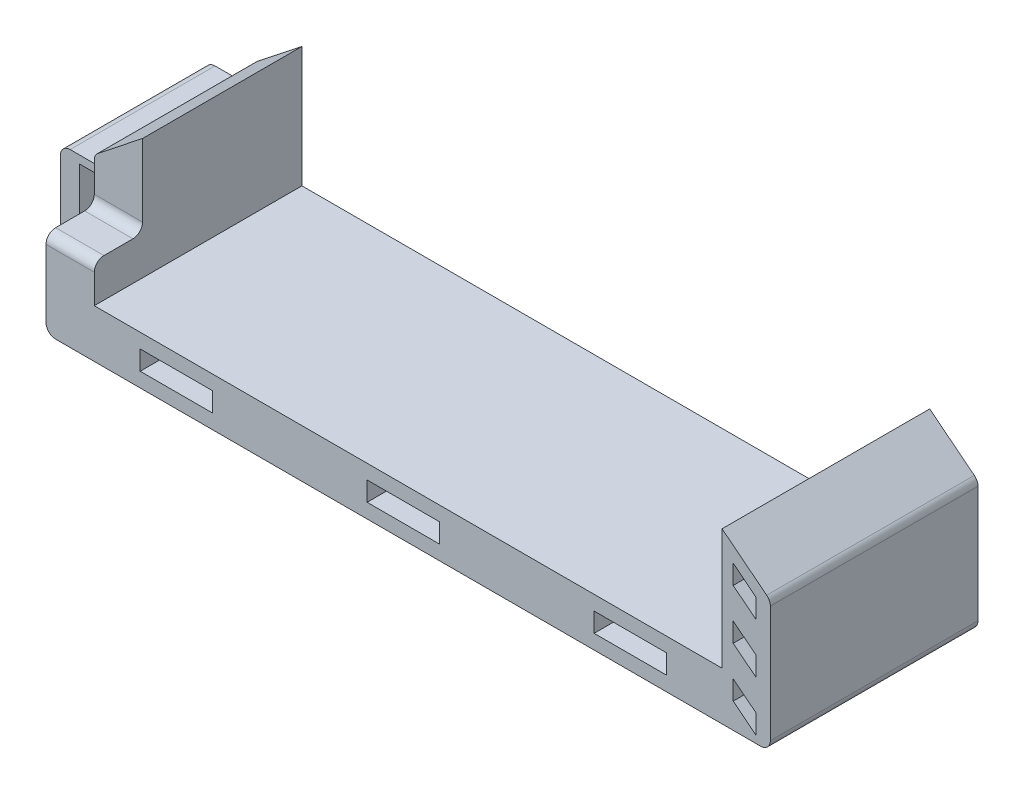
from build123d import *

# Parameters (mm, degrees)
EXTRUDE_1_DEPTH     = 43
SKETCH_2_W          = 10
SKETCH_2_H          = 17
CUT_EXTRUDE_1_DEPTH = 43
EXTRUDE_2_DEPTH     = 30
SKETCH_5_W          = 15
SKETCH_5_H          = 4
CUT_EXTRUDE_3_DEPTH = 99.440034066
CUT_EXTRUDE_4_DEPTH = 99.440034066
FILLET_1_R          = 2
FILLET_START        = 0.132447056
FILLET_2_DEPTH      = 43.867552944
FILLET_3_R          = 2
SKETCH_7_W          = 7
SKETCH_7_H          = 15
CUT_EXTRUDE_5_DEPTH = 17
FILLET_4_R          = 2


with BuildPart() as part:
    # Эскиз1 → Бобышка-Вытянуть1 (new body)
    with BuildSketch(Plane.XY):
        Polygon((-61.18540146, 10.360583942), (68.81459854, 10.360583942), (68.81459854, 35.360583942), (78.81459854, 27.459854015), (78.81459854, 0.360583942), (-71.18540146, 0.360583942), (-71.18540146, 27.459854015), (-61.18540146, 35.360583942), align=None)
    extrude(amount=EXTRUDE_1_DEPTH)

    # Эскиз2 → Вырез-Вытянуть1 (cut)
    with BuildSketch(Plane(origin=(-61.18540146, 0, 0), x_dir=(0, 0, -1), z_dir=(1, 0, 0))):
        with Locations((-38, 26.860583942)):
            Rectangle(SKETCH_2_W, SKETCH_2_H)
    extrude(amount=-CUT_EXTRUDE_1_DEPTH, mode=Mode.SUBTRACT)

    # Эскиз3 → Бобышка-Вытянуть2 (add)
    with BuildSketch(Plane.XY):
        Polygon((-71.18540146, 18.360583942), (-71.18540146, 22.873529361), (-81.18540146, 22.873529361), (-81.18540146, 18.360583942), (-81.18540146, 4.73264295), (-71.18540146, 4.73264295), align=None)
    extrude(amount=EXTRUDE_2_DEPTH)

    # Эскиз5 → Вырез-Вытянуть3 (cut, through all)
    with BuildSketch(Plane.XY.offset(43)):
        with Locations((2.81459854, 5.360583942)):
            Rectangle(SKETCH_5_W, SKETCH_5_H)
        with Locations((-44.18540146, 5.360583942)):
            Rectangle(SKETCH_5_W, SKETCH_5_H)
        with Locations((49.81459854, 5.360583942)):
            Rectangle(SKETCH_5_W, SKETCH_5_H)
    extrude(amount=-CUT_EXTRUDE_3_DEPTH, mode=Mode.SUBTRACT)

    # Эскиз6 → Вырез-Вытянуть4 (cut, through all)
    with BuildSketch(Plane.XY.offset(43)):
        Polygon((71.115819654, 30.345691142), (75.823743696, 26.626087505), (75.823743696, 22.626087505), (71.115819654, 26.345691142), align=None)
        Polygon((71.115819654, 19.973455793), (75.823743696, 16.253852156), (75.823743696, 12.253852156), (71.115819654, 15.973455793), align=None)
        Polygon((71.115819654, 9.601220443), (75.823743696, 5.881616806), (75.823743696, 1.881616806), (71.115819654, 5.601220443), align=None)
    extrude(amount=-CUT_EXTRUDE_4_DEPTH, mode=Mode.SUBTRACT)

    # Скругление1
    fillet_1_edges = [part.edges().sort_by_distance(p)[0] for p in [
        (78.81459854, 27.459854015, 21.5),
        (78.81459854, 0.360583942, 21.5),
        (-71.18540146, 27.459854015, 16.5),
    ]]
    fillet(fillet_1_edges, radius=FILLET_1_R)

    # Скругление2: read off the stored shape, not the designer's step
    # Скругление2 outline → Скругление2 (cut)
    with BuildSketch(Plane.XY.offset(FILLET_START)):
        with BuildLine():
            Line((-71.18540146, 0.360583942), (-69.18540146, 0.360583942))
            ThreePointArc((-69.18540146, 0.360583942), (-70.599615022, 0.94637038), (-71.18540146, 2.360583942))
            Line((-71.18540146, 2.360583942), (-71.18540146, 0.360583942))
        make_face()
    extrude(amount=FILLET_2_DEPTH, mode=Mode.SUBTRACT)

    # Скругление3
    fillet_3_edges = [part.edges().sort_by_distance(p)[0] for p in [
        (-66.18540146, 18.360583942, 43),
        (-66.18540146, 18.360583942, 33),
    ]]
    fillet(fillet_3_edges, radius=FILLET_3_R)

    # Эскиз7 → Вырез-Вытянуть5 (cut)
    with BuildSketch(Plane.XY.offset(30)):
        with Locations((-73.719422713, 13.759023225)):
            Rectangle(SKETCH_7_W, SKETCH_7_H)
    extrude(amount=-CUT_EXTRUDE_5_DEPTH, mode=Mode.SUBTRACT)

    # Скругление4
    fillet_4_edges = [part.edges().sort_by_distance(p)[0] for p in [
        (-81.18540146, 4.73264295, 15),
        (-71.18540146, 4.73264295, 15),
        (-71.18540146, 22.873529361, 15),
        (-81.18540146, 22.873529361, 15),
    ]]
    fillet(fillet_4_edges, radius=FILLET_4_R)


solid = part.part
